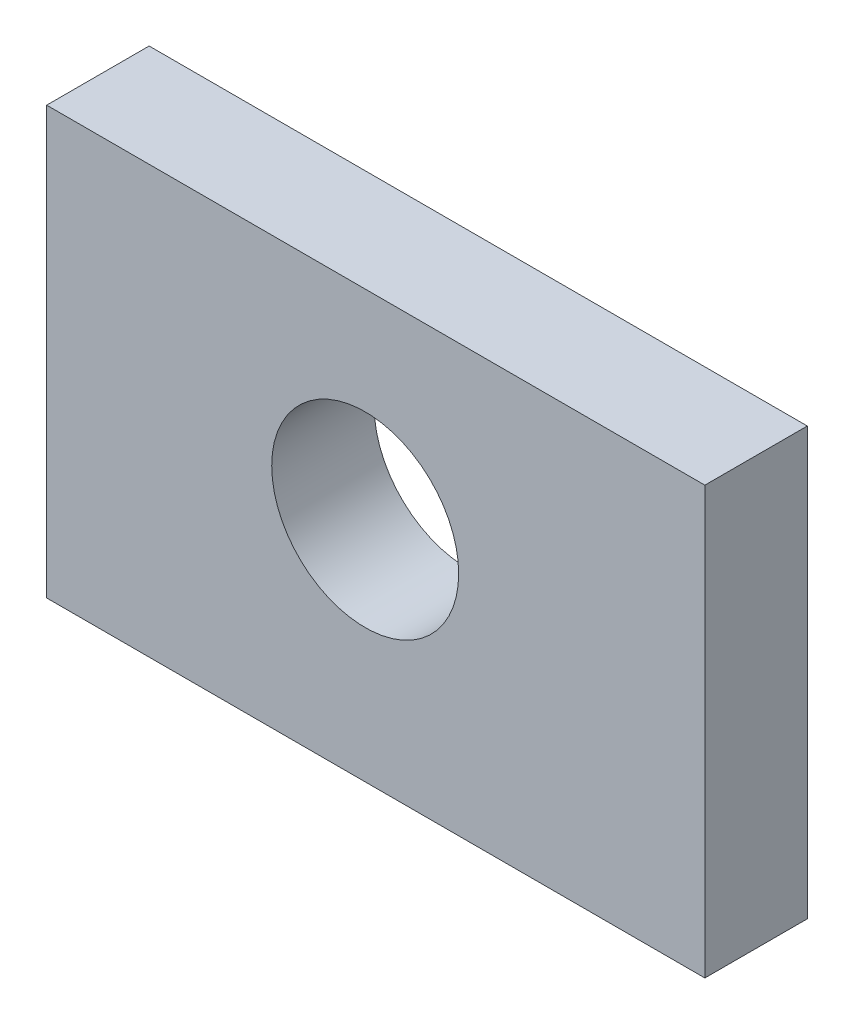
from build123d import *

# Parameters (mm, degrees)
SKETCH_1_W          = 38.55
SKETCH_1_H          = 25
EXTRUDE_1_DEPTH     = 6
SKETCH_2_R          = 5.475
CUT_EXTRUDE_1_DEPTH = 40.300671183


with BuildPart() as part:
    # Эскиз1 → Бобышка-Вытянуть1 (new body)
    with BuildSketch(Plane.XY):
        with Locations((4.02043073, 18.578379342)):
            Rectangle(SKETCH_1_W, SKETCH_1_H)
    extrude(amount=EXTRUDE_1_DEPTH)

    # Эскиз2 → Вырез-Вытянуть1 (cut, through all)
    with BuildSketch(Plane.XY.offset(6)):
        with Locations((3.40043073, 19.378379342)):
            Circle(SKETCH_2_R)
    extrude(amount=-CUT_EXTRUDE_1_DEPTH, mode=Mode.SUBTRACT)


solid = part.part
